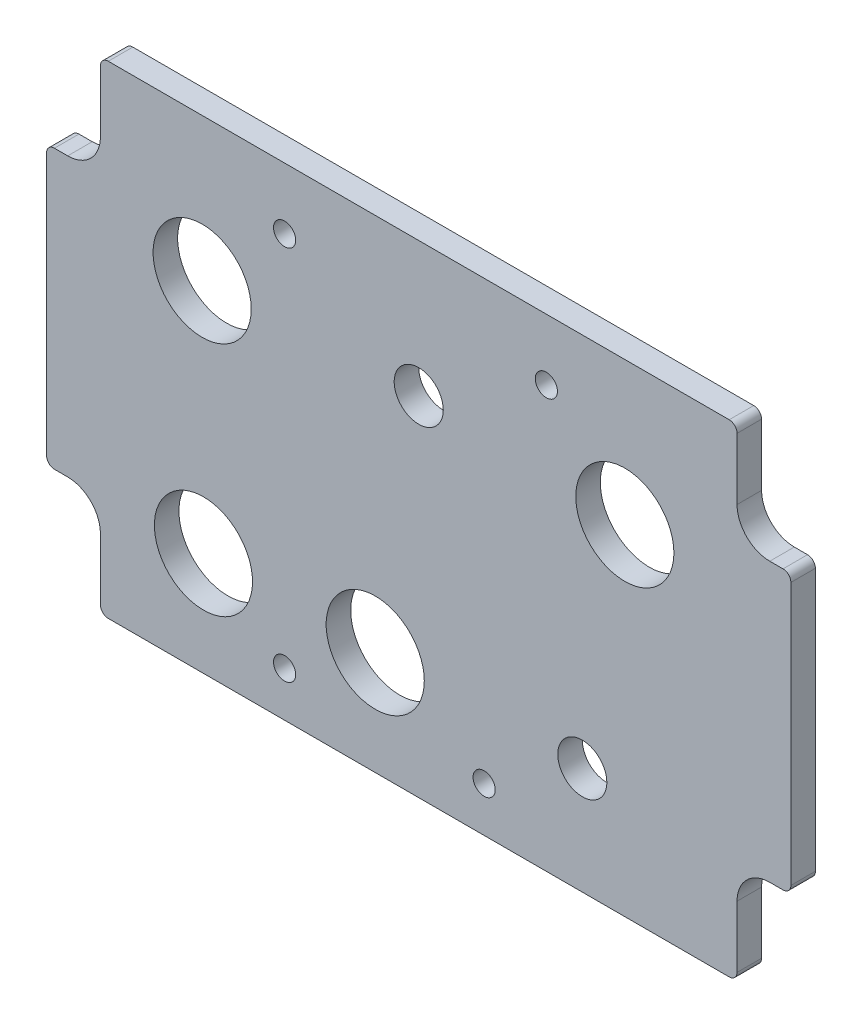
from build123d import *

# Parameters (mm, degrees)
BOSS_EXTRUDE1_DEPTH   = 4.7625
F_6_CLEARANCE_HOLE1_D = 4.3053
SKETCH4_R             = 4.7625
SKETCH4_R_2           = 9.525
CUT_EXTRUDE1_DEPTH    = 174.33217455


with BuildPart() as part:
    # Sketch1 → Boss-Extrude1 (new body)
    with BuildSketch(Plane.XY):
        with BuildLine():
            Line((133.2865, 94.45625), (12.7635, 94.45625))
            ThreePointArc((12.7635, 94.45625), (11.685869265, 94.009880735), (11.2395, 92.93225))
            Line((11.2395, 92.93225), (11.2395, 80.9625))
            ThreePointArc((11.2395, 80.9625), (9.379628061, 76.472371939), (4.8895, 74.6125))
            Line((4.8895, 74.6125), (2.31775, 74.6125))
            ThreePointArc((2.31775, 74.6125), (1.240119265, 74.166130735), (0.79375, 73.0885))
            Line((0.79375, 73.0885), (0.79375, 22.1615))
            ThreePointArc((0.79375, 22.1615), (1.240119265, 21.083869265), (2.31775, 20.6375))
            Line((2.31775, 20.6375), (4.8895, 20.6375))
            ThreePointArc((4.8895, 20.6375), (9.379628061, 18.777628061), (11.2395, 14.2875))
            Line((11.2395, 14.2875), (11.2395, 2.31775))
            ThreePointArc((11.2395, 2.31775), (11.685869265, 1.240119265), (12.7635, 0.79375))
            Line((12.7635, 0.79375), (133.2865, 0.79375))
            ThreePointArc((133.2865, 0.79375), (134.364130735, 1.240119265), (134.8105, 2.31775))
            Line((134.8105, 2.31775), (134.8105, 14.2875))
            ThreePointArc((134.8105, 14.2875), (136.670371939, 18.777628061), (141.1605, 20.6375))
            Line((141.1605, 20.6375), (143.73225, 20.6375))
            ThreePointArc((143.73225, 20.6375), (144.809880735, 21.083869265), (145.25625, 22.1615))
            Line((145.25625, 22.1615), (145.25625, 73.0885))
            ThreePointArc((145.25625, 73.0885), (144.809880735, 74.166130735), (143.73225, 74.6125))
            Line((143.73225, 74.6125), (141.1605, 74.6125))
            ThreePointArc((141.1605, 74.6125), (136.670371939, 76.472371939), (134.8105, 80.9625))
            Line((134.8105, 80.9625), (134.8105, 92.93225))
            ThreePointArc((134.8105, 92.93225), (134.364130735, 94.009880735), (133.2865, 94.45625))
        make_face()
    extrude(amount=BOSS_EXTRUDE1_DEPTH)

    # #6 Clearance Hole1 (through all)
    with Locations(Plane.XY.offset(4.7625)):
        with Locations((46.99, 82.55), (97.79, 82.55), (85.725, 9.525), (46.99, 9.525)):
            Hole(F_6_CLEARANCE_HOLE1_D / 2)

    # Sketch4 → Cut-Extrude1 (cut, through all)
    with BuildSketch(Plane.XY.offset(4.7625)):
        with Locations((73.025, 68.326)):
            Circle(SKETCH4_R)
        with Locations((104.775, 21.59)):
            Circle(SKETCH4_R)
        with Locations((30.988, 66.675)):
            Circle(SKETCH4_R_2)
        with Locations((113.03, 66.675)):
            Circle(SKETCH4_R_2)
        with Locations((31.242, 20.955)):
            Circle(SKETCH4_R_2)
        with Locations((64.5795, 20.955)):
            Circle(SKETCH4_R_2)
    extrude(amount=-CUT_EXTRUDE1_DEPTH, mode=Mode.SUBTRACT)


solid = part.part
